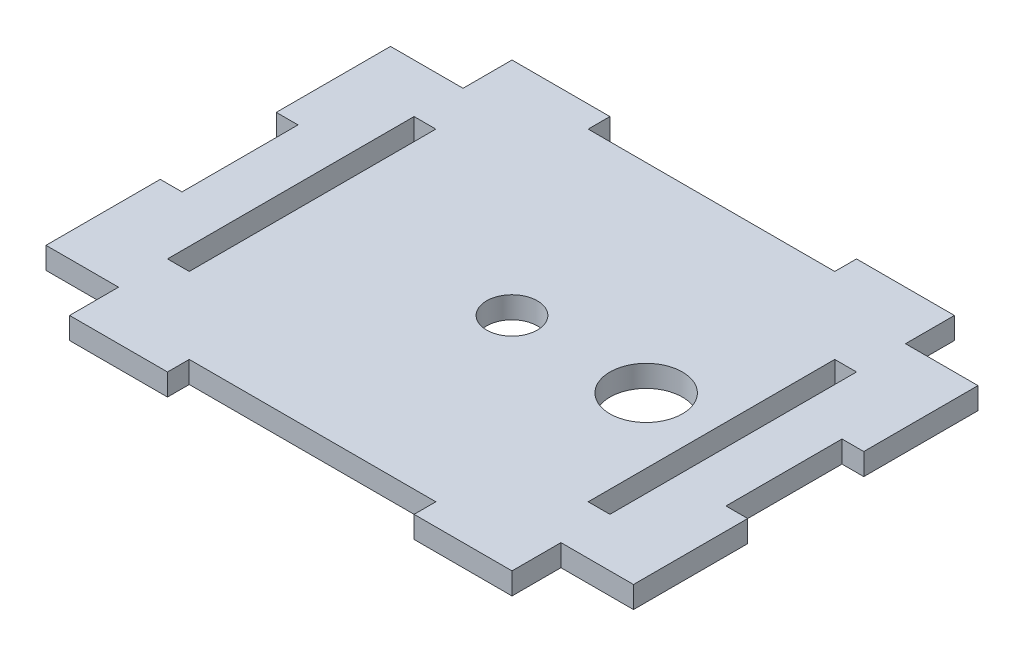
from build123d import *

# Parameters (mm, degrees)
CROQUIS1_R              = 3.5
CROQUIS1_R_2            = 5
SALIENTE_EXTRUIR1_DEPTH = 3


with BuildPart() as part:
    # Croquis1 → Saliente-Extruir1 (new body)
    with BuildSketch(Plane(origin=(0, 0, 0), x_dir=(1, 0, 0), z_dir=(0, 1, 0))):
        Polygon((17, 27.5), (0, 27.5), (-17, 27.5), (-17, 30.5), (-23.75, 30.5), (-30.5, 30.5), (-30.5, 23.75), (-40.5, 23.75), (-40.5, 8), (-37.5, 8), (-37.5, 0), (-37.5, -8), (-40.5, -8), (-40.5, -23.75), (-30.5, -23.75), (-30.5, -30.5), (-23.75, -30.5), (-17, -30.5), (-17, -27.5), (0, -27.5), (17, -27.5), (17, -30.5), (23.75, -30.5), (30.5, -30.5), (30.5, -23.75), (40.5, -23.75), (40.5, -8), (37.5, -8), (37.5, 0), (37.5, 8), (40.5, 8), (40.5, 23.75), (30.5, 23.75), (30.5, 30.5), (23.75, 30.5), (17, 30.5), align=None)
        Polygon((30.5, 17), (30.5, -17), (27.5, -17), (27.5, 0), (27.5, 17), align=None, mode=Mode.SUBTRACT)
        Polygon((-27.5, 17), (-27.5, 0), (-27.5, -17), (-30.5, -17), (-30.5, 17), align=None, mode=Mode.SUBTRACT)
        Circle(CROQUIS1_R, mode=Mode.SUBTRACT)
        with Locations((18.5, 0)):
            Circle(CROQUIS1_R_2, mode=Mode.SUBTRACT)
    extrude(amount=SALIENTE_EXTRUIR1_DEPTH)


solid = part.part
